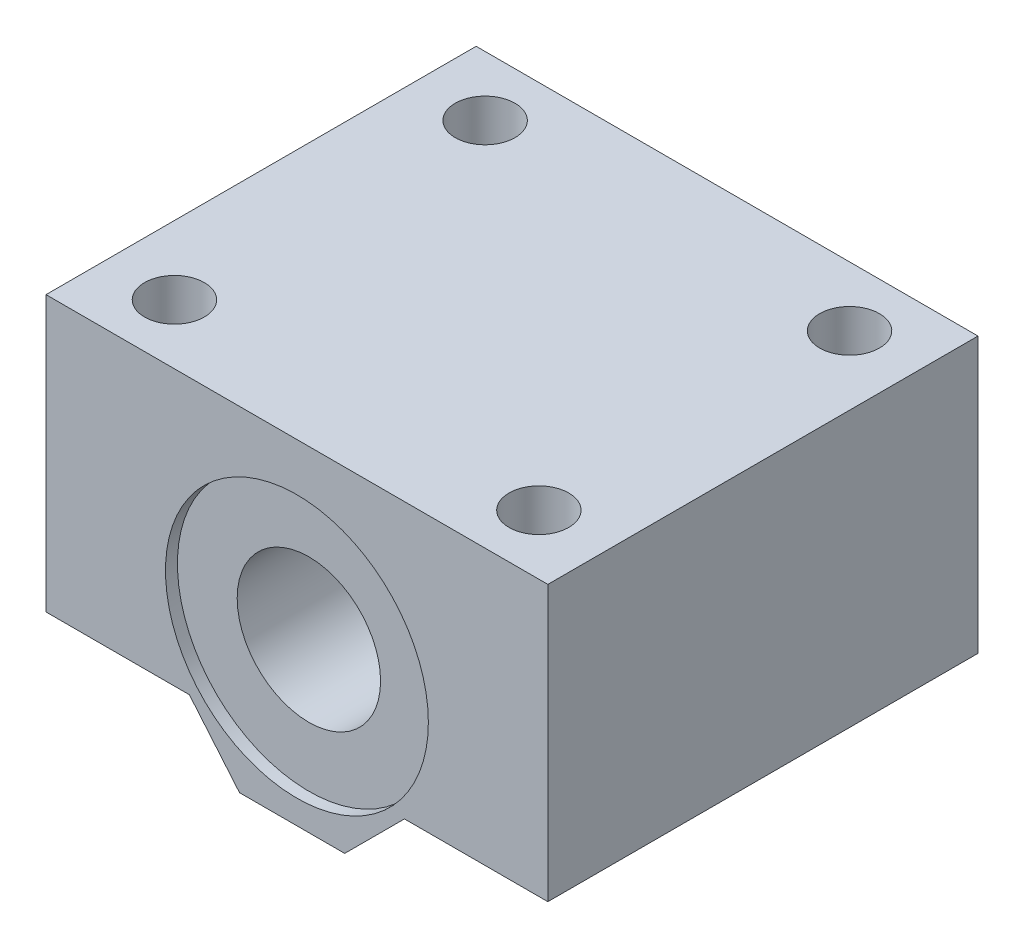
from build123d import *

# Parameters (mm, degrees)
SKETCH1_W           = 42
SKETCH1_H           = 28
SKETCH1_R           = 6
BOSS_EXTRUDE1_DEPTH = 18
CUT_EXTRUDE5_DEPTH  = 44.965895874
SKETCH2_R           = 2.15
CUT_EXTRUDE1_DEPTH  = 40.357337308
SKETCH3_R           = 2.5
CUT_EXTRUDE2_DEPTH  = 12
SKETCH4_R           = 11
CUT_EXTRUDE3_DEPTH  = 1
CUT_EXTRUDE4_START  = -1
SKETCH5_R           = 11
CUT_EXTRUDE4_DEPTH  = 1


with BuildPart() as part:
    # Sketch1 → Boss-Extrude1 (new, symmetric)
    with BuildSketch(Plane.XY):
        Rectangle(SKETCH1_W, SKETCH1_H)
        with Locations((0, -1)):
            Circle(SKETCH1_R, mode=Mode.SUBTRACT)
    extrude(amount=BOSS_EXTRUDE1_DEPTH, both=True)

    # Sketch6 → Cut-Extrude5 (cut, through all)
    with BuildSketch(Plane.XY.offset(18)):
        Polygon((-21, -9), (-9, -9), (-4.804501844, -14), (-21, -14), align=None)
        Polygon((21, -9), (9, -9), (4, -14), (21, -14), align=None)
    extrude(amount=-CUT_EXTRUDE5_DEPTH, mode=Mode.SUBTRACT)

    # Sketch2 → Cut-Extrude1 (cut, through all)
    with BuildSketch(Plane(origin=(0, 14, 0), x_dir=(-1, 0, 0), z_dir=(0, -1, 0))):
        with Locations((15.25, -13)):
            Circle(SKETCH2_R)
        with Locations((-15.25, -13)):
            Circle(SKETCH2_R)
        with Locations((-15.25, 13)):
            Circle(SKETCH2_R)
        with Locations((15.25, 13)):
            Circle(SKETCH2_R)
    extrude(amount=CUT_EXTRUDE1_DEPTH, mode=Mode.SUBTRACT)

    # Sketch3 → Cut-Extrude2 (cut)
    with BuildSketch(Plane.XZ.offset(-14)):
        with Locations((-15.25, 13)):
            Circle(SKETCH3_R)
        with Locations((15.25, 13)):
            Circle(SKETCH3_R)
        with Locations((15.25, -13)):
            Circle(SKETCH3_R)
        with Locations((-15.25, -13)):
            Circle(SKETCH3_R)
    extrude(amount=CUT_EXTRUDE2_DEPTH, mode=Mode.SUBTRACT)

    # Sketch4 → Cut-Extrude3 (cut)
    with BuildSketch(Plane.XY.offset(18)):
        with Locations((0, -1)):
            Circle(SKETCH4_R)
    extrude(amount=-CUT_EXTRUDE3_DEPTH, mode=Mode.SUBTRACT)

    # Sketch5 → Cut-Extrude4 (cut)
    with BuildSketch(Plane(origin=(0, 0, -18), x_dir=(-1, 0, 0), z_dir=(0, 0, -1)).offset(CUT_EXTRUDE4_START)):
        with Locations((0, -1)):
            Circle(SKETCH5_R)
    extrude(amount=CUT_EXTRUDE4_DEPTH, mode=Mode.SUBTRACT)


solid = part.part
